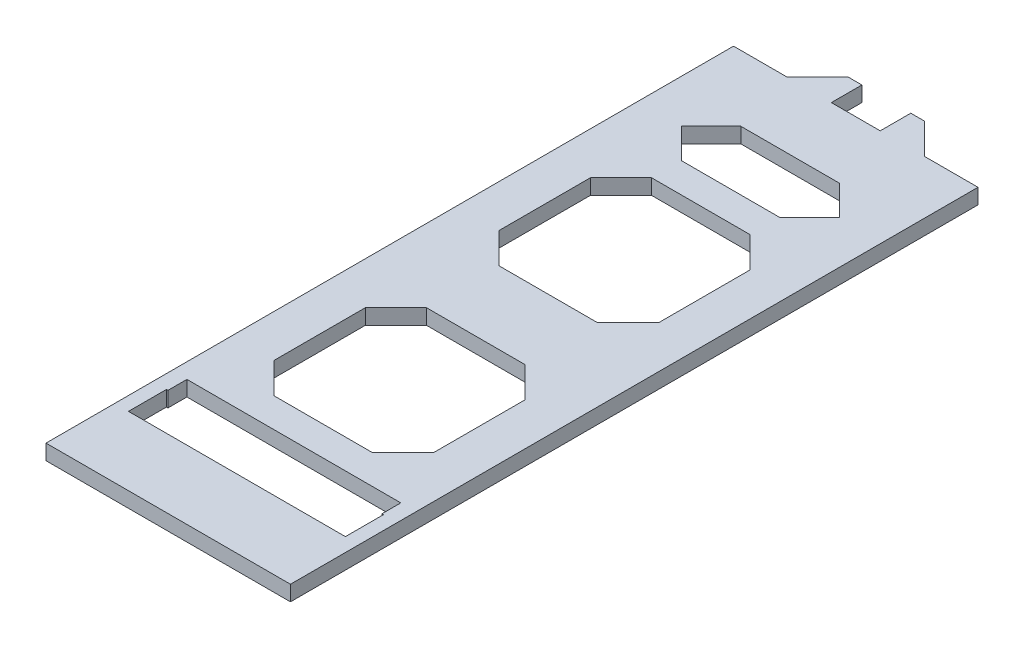
from build123d import *

# Parameters (mm, degrees)
BOSS_EXTRUDE1_DEPTH = 5
CHAMFER1_SIZE       = 10
SKETCH2_W           = 52.240142394
SKETCH2_H           = 49.910170897
SKETCH2_H_2         = 19.468376047
CUT_EXTRUDE1_DEPTH  = 5
CHAMFER2_SIZE       = 10


# Some blends are built 0.0001 mm under size
with BuildPart() as part:
    # Sketch1 → Boss-Extrude1 (new body)
    with BuildSketch(Plane(origin=(0, 0, 0), x_dir=(1, 0, 0), z_dir=(0, 1, 0))):
        Polygon((12.5, 112.5), (40, 112.5), (40, -112.5), (-40, -112.5), (-40, 112.5), (-12.5, 112.5), (-12.5, 122.5), (-8, 122.5), (-8, 112.5), (8, 112.5), (8, 122.5), (12.5, 122.5), align=None)
        Polygon((35, -71.386750493), (35, -77.596695784), (35.5, -77.596695784), (35.5, -90.016586366), (-35.5, -90.016586366), (-35.5, -77.596695784), (-35, -77.596695784), (-35, -71.386750493), align=None, mode=Mode.SUBTRACT)
    extrude(amount=BOSS_EXTRUDE1_DEPTH)

    # Chamfer1
    chamfer1_edges = [part.edges().sort_by_distance(p)[0] for p in [
        (-12.5, 2.5, -112.5),
        (12.5, 2.5, -112.5),
    ]]
    chamfer(chamfer1_edges, length=CHAMFER1_SIZE - 0.0001)  # a hair under: the kernel refuses the full size

    # Sketch2 → Cut-Extrude1 (cut)
    with BuildSketch(Plane(origin=(0, 5, 0), x_dir=(1, 0, 0), z_dir=(0, 1, 0))):
        with Locations((0, 36.827678023)):
            Rectangle(SKETCH2_W, SKETCH2_H)
        with Locations((0, -36.827678023)):
            Rectangle(SKETCH2_W, SKETCH2_H)
        with Locations((0, 81.251139518)):
            Rectangle(SKETCH2_W, SKETCH2_H_2)
    extrude(amount=-CUT_EXTRUDE1_DEPTH, mode=Mode.SUBTRACT)

    # Chamfer2
    # the kernel refuses this chamfer: 10 mm, written as the material it adds along each edge
    with BuildSketch(Plane(origin=(26.120071197, 5, -90.985327541), x_dir=(-0.9996219169112968, 0, -0.027495876610586317), z_dir=(0, -1, 0)), Plane(origin=(26.120071197, 5, -71.516951494), x_dir=(0.027495876610586317, 0, -0.9996219169112968), z_dir=(0, -1, 0)), Plane(origin=(-26.120071197, 5, -71.516951494), x_dir=(0.9996219169112968, 0, 0.027495876610586317), z_dir=(0, -1, 0)), Plane(origin=(-26.120071197, 5, 11.872592574), x_dir=(-0.027495876610586667, 0, 0.9996219169112968), z_dir=(0, -1, 0)), Plane(origin=(26.120071197, 5, 11.872592574), x_dir=(-0.9996219169112968, 0, -0.027495876610586317), z_dir=(0, -1, 0)), Plane(origin=(26.120071197, 5, 61.782763471), x_dir=(0.027495876610586317, 0, -0.9996219169112968), z_dir=(0, -1, 0)), Plane(origin=(26.120071197, 5, -61.782763471), x_dir=(-0.9996219169112968, 0, -0.027495876610586317), z_dir=(0, -1, 0)), Plane(origin=(26.120071197, 5, -11.872592574), x_dir=(0.027495876610586324, 0, -0.9996219169112968), z_dir=(0, -1, 0)), Plane(origin=(-26.120071197, 5, -61.782763471), x_dir=(-0.027495876610585973, 0, 0.9996219169112968), z_dir=(0, -1, 0))) as chamfer2_piece_1:
        Polygon((CHAMFER2_SIZE * 0.999621916911, -CHAMFER2_SIZE * 0.0274958766106), (-CHAMFER2_SIZE * 0.0274958766106, -CHAMFER2_SIZE * 0.999621916911), (0, 0), align=None)
    extrude(amount=5)
    with BuildSketch(Plane(origin=(-26.120071197, 5, -90.985327541), x_dir=(0.9996219169112968, 0, -0.027495876610586317), z_dir=(0, -1, 0)), Plane(origin=(-26.120071197, 5, 61.782763471), x_dir=(-0.027495876610585973, 0, -0.9996219169112968), z_dir=(0, -1, 0)), Plane(origin=(-26.120071197, 5, -11.872592574), x_dir=(-0.027495876610586667, 0, -0.9996219169112968), z_dir=(0, -1, 0))) as chamfer2_piece_2:
        Polygon((CHAMFER2_SIZE * 0.999621916911, CHAMFER2_SIZE * 0.0274958766106), (-CHAMFER2_SIZE * 0.0274958766106, CHAMFER2_SIZE * 0.999621916911), (0, 0), align=None)
    extrude(amount=5)


solid = part.part
